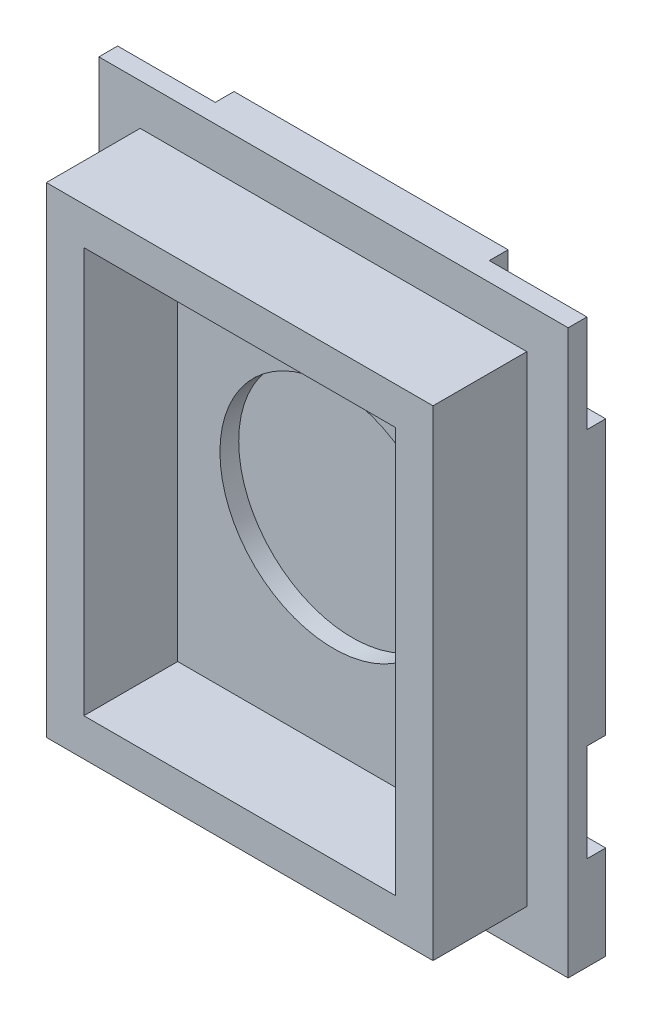
from build123d import *

# Parameters (mm, degrees)
SKETCH_1_W          = 25
SKETCH_1_H          = 30
EXTRUDE_1_DEPTH     = 2
SKETCH_2_W          = 20.6
SKETCH_2_H          = 25.6
EXTRUDE_2_DEPTH     = 5
SKETCH_3_W          = 16.6
SKETCH_3_H          = 21.6
CUT_EXTRUDE_1_DEPTH = 5
SKETCH_4_W          = 5.2
SKETCH_4_H          = 5.2
CUT_EXTRUDE_2_DEPTH = 1
SKETCH_5_R          = 6.05
CUT_EXTRUDE_3_DEPTH = 1


with BuildPart() as part:
    # ｽｹｯﾁ1 → ﾎﾞｽ - 押し出し1 (new body)
    with BuildSketch(Plane.XY):
        with Locations((-24.237274581, 24.707142857)):
            Rectangle(SKETCH_1_W, SKETCH_1_H)
    extrude(amount=EXTRUDE_1_DEPTH)

    # ｽｹｯﾁ2 → ﾎﾞｽ - 押し出し2 (add)
    with BuildSketch(Plane.XY.offset(2)):
        with Locations((-24.237274581, 24.707142857)):
            Rectangle(SKETCH_2_W, SKETCH_2_H)
    extrude(amount=EXTRUDE_2_DEPTH)

    # ｽｹｯﾁ3 → ｶｯﾄ - 押し出し1 (cut)
    with BuildSketch(Plane.XY.offset(7)):
        with Locations((-24.237274581, 24.707142857)):
            Rectangle(SKETCH_3_W, SKETCH_3_H)
    extrude(amount=-CUT_EXTRUDE_1_DEPTH, mode=Mode.SUBTRACT)

    # ｽｹｯﾁ4 → ｶｯﾄ - 押し出し2 (cut)
    with BuildSketch(Plane(origin=(0, 0, 0), x_dir=(-1, 0, 0), z_dir=(0, 0, -1))):
        with Locations((14.337274581, 37.107142857)):
            Rectangle(SKETCH_4_W, SKETCH_4_H)
        with Locations((34.137274581, 37.107142857)):
            Rectangle(SKETCH_4_W, SKETCH_4_H)
        with Locations((34.137274581, 17.307142857)):
            Rectangle(SKETCH_4_W, SKETCH_4_H)
        with Locations((14.337274581, 17.307142857)):
            Rectangle(SKETCH_4_W, SKETCH_4_H)
    extrude(amount=-CUT_EXTRUDE_2_DEPTH, mode=Mode.SUBTRACT)

    # ｽｹｯﾁ5 → ｶｯﾄ - 押し出し3 (cut)
    with BuildSketch(Plane.XY.offset(2)):
        with Locations((-24.237274581, 24.707142857)):
            Circle(SKETCH_5_R)
    extrude(amount=-CUT_EXTRUDE_3_DEPTH, mode=Mode.SUBTRACT)


solid = part.part
